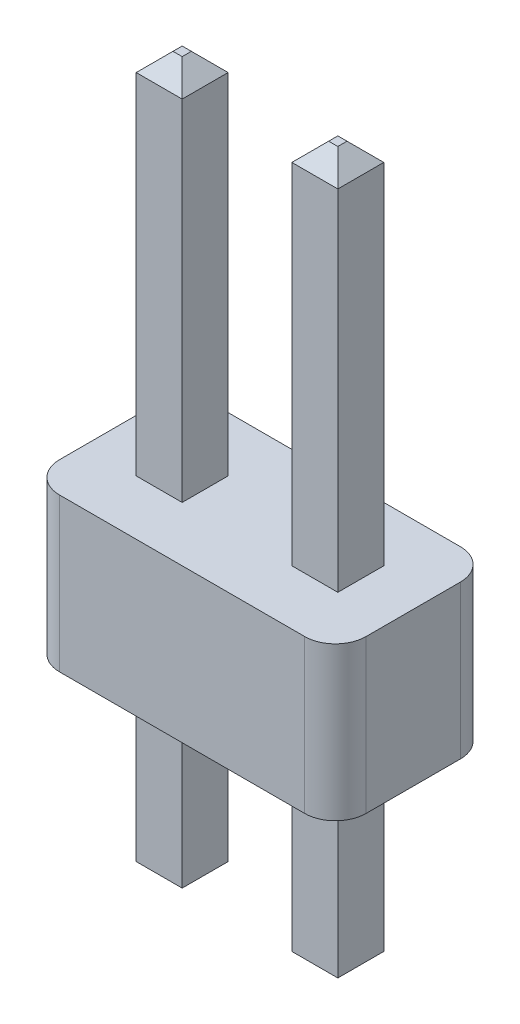
from build123d import *

# Parameters (mm, degrees)
BOSS_EXTRUDE1_DEPTH      = 2.5
BOSS_EXTRUDE2_DEPTH      = 8.5
BOSS_EXTRUDE2_DEPTH_BACK = 3.25
SKETCH2_W                = 0.75
SKETCH2_H                = 0.75
CHAMFER1_SIZE            = 0.3


with BuildPart() as part:
    # Sketch1 → Boss-Extrude1 (new body)
    with BuildSketch(Plane(origin=(0, 0, 0), x_dir=(-1, 0, 0), z_dir=(0, 1, 0))):
        with BuildLine():
            Line((-2, 1.27), (2, 1.27))
            ThreePointArc((2, 1.27), (2.353553391, 1.123553391), (2.5, 0.77))
            Line((2.5, 0.77), (2.5, -0.77))
            ThreePointArc((2.5, -0.77), (2.353553391, -1.123553391), (2, -1.27))
            Line((2, -1.27), (-2, -1.27))
            ThreePointArc((-2, -1.27), (-2.353553391, -1.123553391), (-2.5, -0.77))
            Line((-2.5, -0.77), (-2.5, 0.77))
            ThreePointArc((-2.5, 0.77), (-2.353553391, 1.123553391), (-2, 1.27))
        make_face()
    extrude(amount=BOSS_EXTRUDE1_DEPTH)

    # Sketch2 → Boss-Extrude2 (add, two sides: drawn at the far end of the back side and taken through both)
    with BuildSketch(Plane(origin=(0, 0, 0), x_dir=(-1, 0, 0), z_dir=(0, 1, 0)).offset(-BOSS_EXTRUDE2_DEPTH_BACK)):
        with Locations((1.27, 0)):
            Rectangle(SKETCH2_W, SKETCH2_H)
        with Locations((-1.27, 0)):
            Rectangle(SKETCH2_W, SKETCH2_H)
    extrude(amount=BOSS_EXTRUDE2_DEPTH + BOSS_EXTRUDE2_DEPTH_BACK)

    # Chamfer1
    chamfer1_edges = [part.edges().sort_by_distance(p)[0] for p in [
        (-1.645, 8.5, 0),
        (-1.27, 8.5, -0.375),
        (-0.895, 8.5, 0),
        (-1.27, 8.5, 0.375),
        (0.895, 8.5, 0),
        (1.27, 8.5, -0.375),
        (1.645, 8.5, 0),
        (1.27, 8.5, 0.375),
        (1.27, -3.25, -0.375),
        (1.645, -3.25, 0),
        (0.895, -3.25, 0),
        (1.27, -3.25, 0.375),
        (-1.27, -3.25, 0.375),
        (-1.645, -3.25, 0),
        (-0.895, -3.25, 0),
        (-1.27, -3.25, -0.375),
    ]]
    chamfer(chamfer1_edges, length=CHAMFER1_SIZE)


solid = part.part
